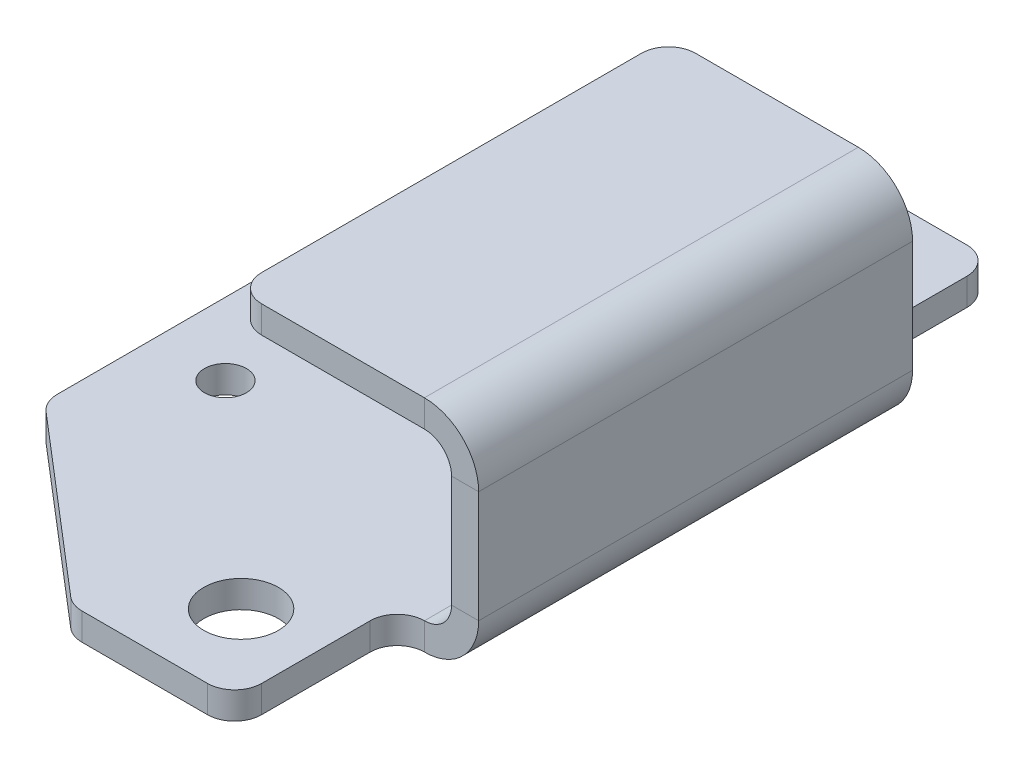
from build123d import *

# Parameters (mm, degrees)
BASE_FLANGE1_DEPTH  = 25.4
SKETCH7_W           = 41.275
SKETCH7_H           = 19.05
BOSS_EXTRUDE1_DEPTH = 3.175
SKETCH6_R           = 2.45745
SKETCH6_R_2         = 4.3688
CUT_EXTRUDE1_DEPTH  = 58.474902009
CUT_EXTRUDE2_DEPTH  = 58.474902009
FILLET1_R           = 3.175


# Sheet-metal steps are written as plain solids
with BuildPart() as part:
    # Sketch1 → Base-Flange1 (new, symmetric)
    with BuildSketch(Plane.XY):
        with BuildLine():
            Line((0, 0), (22.225, 0))
            ThreePointArc((22.225, 0), (24.47006403, -0.92993597), (25.4, -3.175))
            Line((25.4, -3.175), (25.4, -16.256))
            ThreePointArc((25.4, -16.256), (24.47006403, -18.50106403), (22.225, -19.431))
            Line((22.225, -19.431), (-22.225, -19.431))
            Line((-22.225, -19.431), (-22.225, -22.606))
            Line((-22.225, -22.606), (22.225, -22.606))
            ThreePointArc((22.225, -22.606), (26.715128061, -20.746128061), (28.575, -16.256))
            Line((28.575, -16.256), (28.575, -3.175))
            ThreePointArc((28.575, -3.175), (26.715128061, 1.315128061), (22.225, 3.175))
            Line((22.225, 3.175), (0, 3.175))
            Line((0, 3.175), (0, 0))
        make_face()
    extrude(amount=BASE_FLANGE1_DEPTH, both=True)

    # Sketch7 → Boss-Extrude1 (add)
    with BuildSketch(Plane.XZ.offset(22.606)):
        with Locations((-1.5875, 34.925)):
            Rectangle(SKETCH7_W, SKETCH7_H)
        with Locations((-1.5875, -34.925)):
            Rectangle(SKETCH7_W, SKETCH7_H)
    extrude(amount=-BOSS_EXTRUDE1_DEPTH)

    # Sketch6 → Cut-Extrude1 (cut, through all)
    with BuildSketch(Plane(origin=(0, -19.431, 0), x_dir=(1, 0, 0), z_dir=(0, 1, 0))):
        with Locations(Location((-13.7668, 12.7, 0), (0, 0, 180))):
            Circle(SKETCH6_R)
        with Locations(Location((-13.7668, -12.7, 0), (0, 0, 180))):
            Circle(SKETCH6_R)
        with Locations(Location((10.287, -34.925, 0), (0, 0, 180))):
            Circle(SKETCH6_R_2)
        with Locations(Location((10.287, 34.925, 0), (0, 0, 180))):
            Circle(SKETCH6_R_2)
    extrude(amount=-CUT_EXTRUDE1_DEPTH, mode=Mode.SUBTRACT)

    # Sketch8 → Cut-Extrude2 (cut, through all)
    with BuildSketch(Plane(origin=(0, -19.431, 0), x_dir=(1, 0, 0), z_dir=(0, 1, 0))):
        Polygon((0, -44.45), (-22.225, -25.4), (-22.225, -44.45), align=None)
        Polygon((-22.225, 44.45), (-22.225, 25.4), (0, 44.45), align=None)
    extrude(amount=-CUT_EXTRUDE2_DEPTH, mode=Mode.SUBTRACT)

    # Fillet1
    fillet1_edges = [part.edges().sort_by_distance(p)[0] for p in [
        (0, 1.5875, -25.4),
        (0, 1.5875, 25.4),
        (19.05, -21.0185, -25.4),
        (19.05, -21.0185, -44.45),
        (19.05, -21.0185, 25.4),
        (19.05, -21.0185, 44.45),
        (0, -21.0185, 44.45),
        (-22.225, -21.0185, 25.4),
        (0, -21.0185, -44.45),
        (-22.225, -21.0185, -25.4),
    ]]
    fillet(fillet1_edges, radius=FILLET1_R)


solid = part.part
